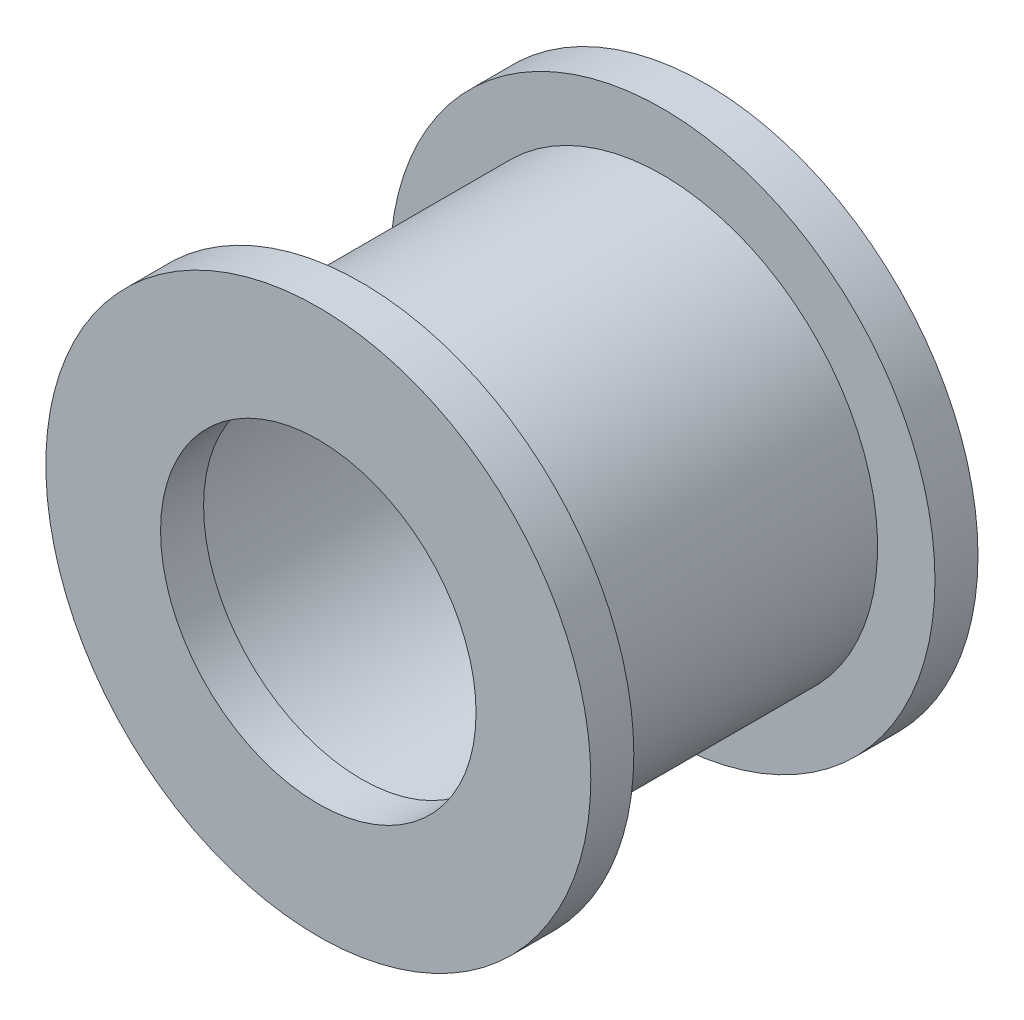
from build123d import *

# Parameters (mm, degrees)
ESQUISSE1_R        = 9.5
ESQUISSE1_R_2      = 5.5
BOSS_EXTRU_1_DEPTH = 1.5
ESQUISSE1_3_R      = 6.45
ESQUISSE1_3_R_2    = 5.5
BOSS_EXTRU_4_DEPTH = 1.5
ESQUISSE6_R        = 7.5
ESQUISSE6_R_2      = 6.5
BOSS_EXTRU_5_DEPTH = 10.5
ESQUISSE7_R        = 9.5
ESQUISSE7_R_2      = 5.5
BOSS_EXTRU_6_DEPTH = 1.5


with BuildPart() as part:
    # Esquisse1 → Boss.-Extru.1 (new body)
    with BuildSketch(Plane.XY):
        Circle(ESQUISSE1_R)
        Circle(ESQUISSE1_R_2, mode=Mode.SUBTRACT)
    extrude(amount=BOSS_EXTRU_1_DEPTH)

    # Esquisse1<3> → Boss.-Extru.4 (add)
    with BuildSketch(Plane.XY):
        Circle(ESQUISSE1_3_R)
        Circle(ESQUISSE1_3_R_2, mode=Mode.SUBTRACT)
    extrude(amount=BOSS_EXTRU_4_DEPTH)

    # Esquisse6 → Boss.-Extru.5 (add)
    with BuildSketch(Plane.XY.offset(1.5)):
        Circle(ESQUISSE6_R)
        Circle(ESQUISSE6_R_2, mode=Mode.SUBTRACT)
    extrude(amount=BOSS_EXTRU_5_DEPTH)

    # Esquisse7 → Boss.-Extru.6 (add)
    with BuildSketch(Plane.XY.offset(12)):
        Circle(ESQUISSE7_R)
        Circle(ESQUISSE7_R_2, mode=Mode.SUBTRACT)
    extrude(amount=BOSS_EXTRU_6_DEPTH)


solid = part.part
